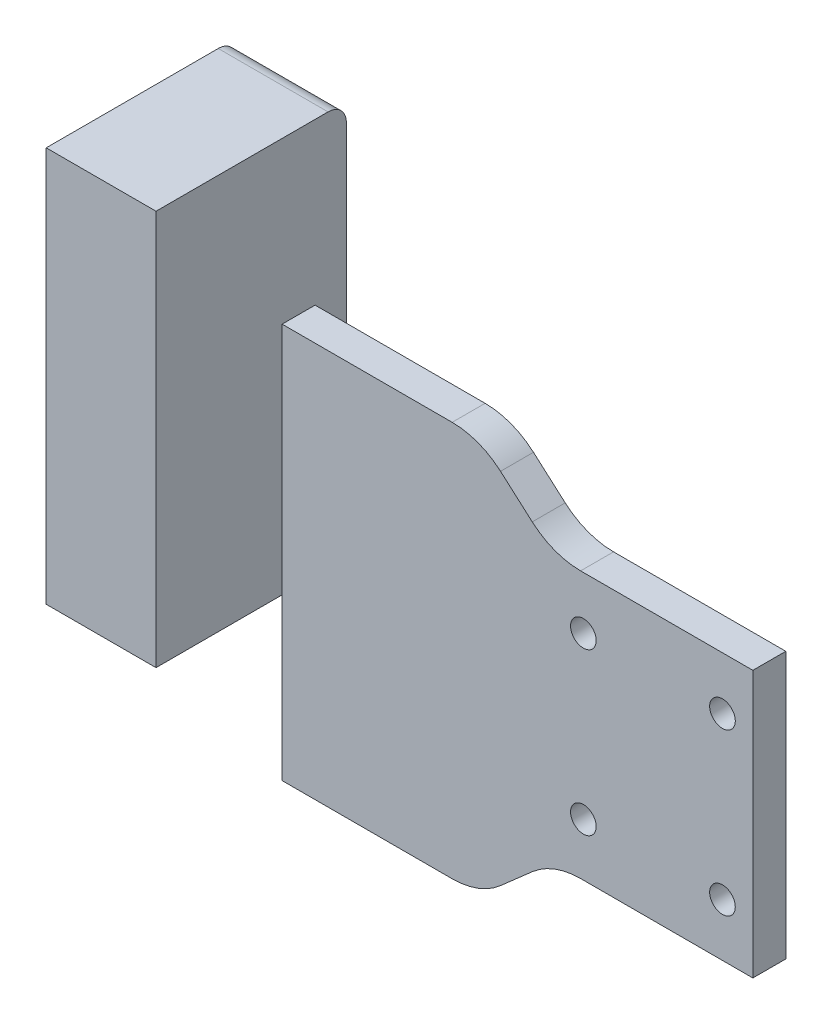
from build123d import *

# Parameters (mm, degrees)
SKETCH1_R           = 1.75
BOSS_EXTRUDE1_DEPTH = 4.5
SKETCH2_W           = 15
SKETCH2_H           = 54
BOSS_EXTRUDE2_DEPTH = 26
FILLET1_R           = 10
FILLET3_R           = 2.5


with BuildPart() as part:
    # Sketch1 → Boss-Extrude1 (new body)
    with BuildSketch(Plane.XY):
        Polygon((-13.65, -18.2), (13.65, -18.2), (13.65, 18.2), (-13.65, 18.2), (-23.65, 27), (-50.65, 27), (-50.65, -27), (-23.65, -27), align=None)
        with Locations((-9.5, 11)):
            Circle(SKETCH1_R, mode=Mode.SUBTRACT)
        with Locations((9.5, 11)):
            Circle(SKETCH1_R, mode=Mode.SUBTRACT)
        with Locations((-9.5, -11)):
            Circle(SKETCH1_R, mode=Mode.SUBTRACT)
        with Locations((9.5, -11)):
            Circle(SKETCH1_R, mode=Mode.SUBTRACT)
    extrude(amount=BOSS_EXTRUDE1_DEPTH)

    # Fillet1
    fillet1_edges = [part.edges().sort_by_distance(p)[0] for p in [
        (-23.65, -27, 2.25),
        (-23.65, 27, 2.25),
        (-13.65, -18.2, 2.25),
        (-13.65, 18.2, 2.25),
    ]]
    fillet(fillet1_edges, radius=FILLET1_R)


with BuildPart() as body_2:
    # Sketch2 → Boss-Extrude2 (new body)
    with BuildSketch(Plane.XY):
        with Locations((-79.876376322, 0.246528417)):
            Rectangle(SKETCH2_W, SKETCH2_H)
    extrude(amount=-BOSS_EXTRUDE2_DEPTH)

    # Fillet3
    fillet3_edges = [body_2.edges().sort_by_distance(p)[0] for p in [
        (-79.876376322, 27.246528417, -26),
        (-79.876376322, -26.753471583, -26),
    ]]
    fillet(fillet3_edges, radius=FILLET3_R)


solid = Compound([part.part, body_2.part])
